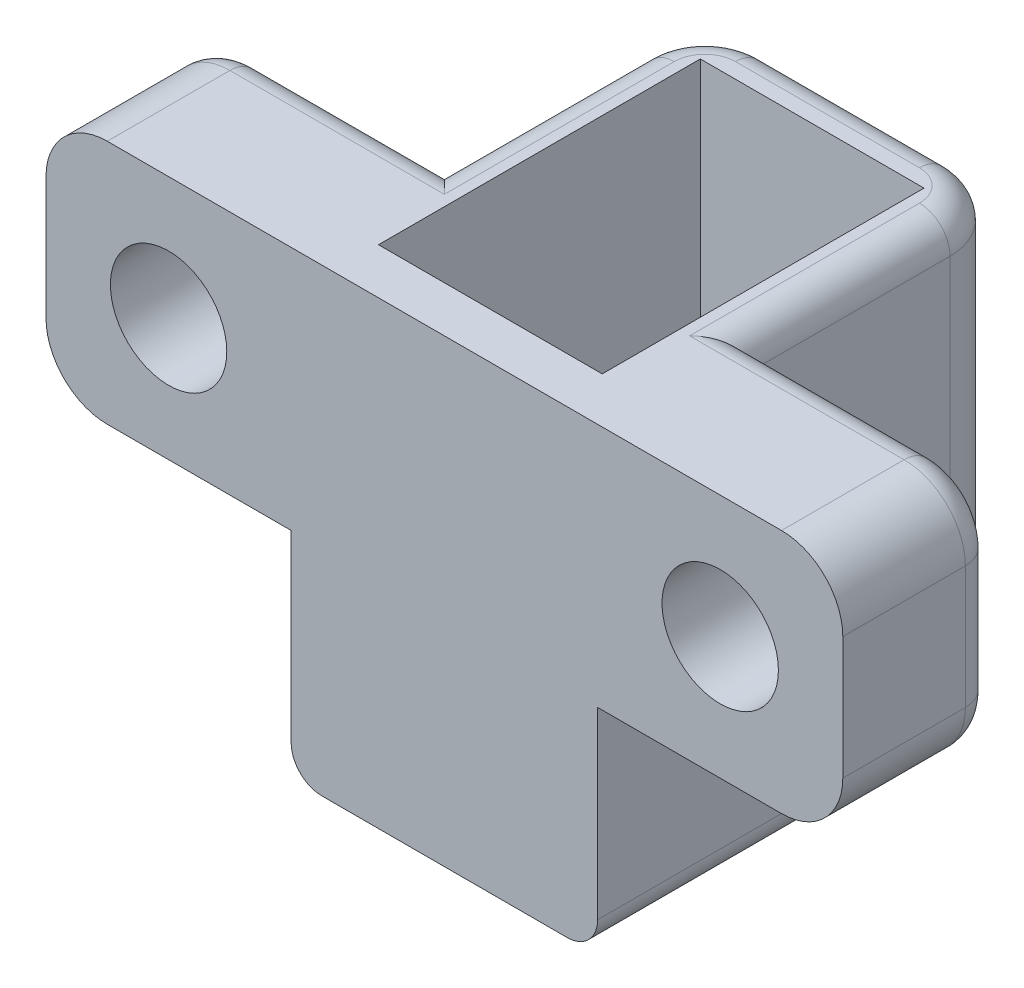
from build123d import *

# Parameters (mm, degrees)
SKETCH1_W             = 10
SKETCH1_H             = 13.5
SKETCH1_W_2           = 7.3
SKETCH1_H_2           = 10.5
BOSS_EXTRUDE1_DEPTH   = 15
SKETCH1_3_W           = 0.5
SKETCH1_3_H           = 10.5
BOSS_EXTRUDE2_DEPTH   = 6.5
BOSS_EXTRUDE3_DEPTH   = 5
F_6_CLEARANCE_HOLE1_D = 3.7973
SKETCH5_W             = 6.3
SKETCH5_H             = 10.5
SKETCH5_W_2           = 4.3
SKETCH5_H_2           = 8.5
BOSS_EXTRUDE4_DEPTH   = 1.5
FILLET1_R             = 2
FILLET2_SIZE          = 1
FILLET3_R             = 1


with BuildPart() as part:
    # Sketch1 → Boss-Extrude1 (new body)
    with BuildSketch(Plane(origin=(0, 0, 0), x_dir=(1, 0, 0), z_dir=(0, 1, 0))):
        Rectangle(SKETCH1_W, SKETCH1_H)
        Rectangle(SKETCH1_W_2, SKETCH1_H_2, mode=Mode.SUBTRACT)
    extrude(amount=BOSS_EXTRUDE1_DEPTH)

    # Sketch1<3> → Boss-Extrude2 (add)
    with BuildSketch(Plane(origin=(0, 0, 0), x_dir=(1, 0, 0), z_dir=(0, 1, 0))):
        with Locations((-3.4, 0)):
            Rectangle(SKETCH1_3_W, SKETCH1_3_H)
        with Locations((3.4, 0)):
            Rectangle(SKETCH1_3_W, SKETCH1_3_H)
    extrude(amount=BOSS_EXTRUDE2_DEPTH)

    # Sketch2 → Boss-Extrude3 (add)
    with BuildSketch(Plane.XY.offset(6.75)):
        with BuildLine():
            ThreePointArc((13, 13), (12.414213562, 14.414213562), (11, 15))
            Line((11, 15), (5, 15))
            Line((5, 15), (5, 7))
            Line((5, 7), (11, 7))
            ThreePointArc((11, 7), (12.414213562, 7.585786438), (13, 9))
            Line((13, 9), (13, 13))
        make_face()
        with BuildLine():
            Line((-13, 9), (-13, 13))
            ThreePointArc((-13, 13), (-12.414213562, 14.414213562), (-11, 15))
            Line((-11, 15), (-5, 15))
            Line((-5, 15), (-5, 7))
            Line((-5, 7), (-11, 7))
            ThreePointArc((-11, 7), (-12.414213562, 7.585786438), (-13, 9))
        make_face()
    extrude(amount=-BOSS_EXTRUDE3_DEPTH)

    # #6 Clearance Hole1 (through all)
    with Locations(Plane.XY.offset(6.75)):
        with Locations((-9, 11), (9, 11)):
            Hole(F_6_CLEARANCE_HOLE1_D / 2)

    # Sketch5 → Boss-Extrude4 (add)
    with BuildSketch(Plane.XZ):
        Rectangle(SKETCH5_W, SKETCH5_H)
        Rectangle(SKETCH5_W_2, SKETCH5_H_2, mode=Mode.SUBTRACT)
    extrude(amount=-BOSS_EXTRUDE4_DEPTH)

    # Fillet1
    fillet1_edges = [part.edges().sort_by_distance(p)[0] for p in [
        (-5, 7.5, -6.75),
        (5, 7.5, -6.75),
    ]]
    fillet(fillet1_edges, radius=FILLET1_R)

    # Fillet2
    fillet2_edges = [part.edges().sort_by_distance(p)[0] for p in [
        (0, 1.5, -4.25),
        (2.15, 1.5, 0),
        (0, 1.5, 4.25),
        (-2.15, 1.5, 0),
    ]]
    chamfer(fillet2_edges, length=FILLET2_SIZE - 0.0001)  # a hair under: the kernel refuses the full size

    # Fillet3
    fillet3_edges = [part.edges().sort_by_distance(p)[0] for p in [
        (0, 0, -6.75),
        (0, 15, -6.75),
        (5, 0, 1),
        (-5, 0, 1),
        (-4.414213562, 0, -6.164213562),
        (4.414213562, 0, -6.164213562),
        (5, 15, -1.5),
        (-5, 15, -1.5),
        (-4.414213562, 15, -6.164213562),
        (4.414213562, 15, -6.164213562),
        (8, 7, 1.75),
        (8, 15, 1.75),
        (12.414213562, 14.414213562, 1.75),
        (13, 11, 1.75),
        (12.414213562, 7.585786438, 1.75),
        (-12.414213562, 7.585786438, 1.75),
        (-13, 11, 1.75),
        (-12.414213562, 14.414213562, 1.75),
        (-8, 15, 1.75),
        (-8, 7, 1.75),
    ]]
    fillet(fillet3_edges, radius=FILLET3_R)


solid = part.part
